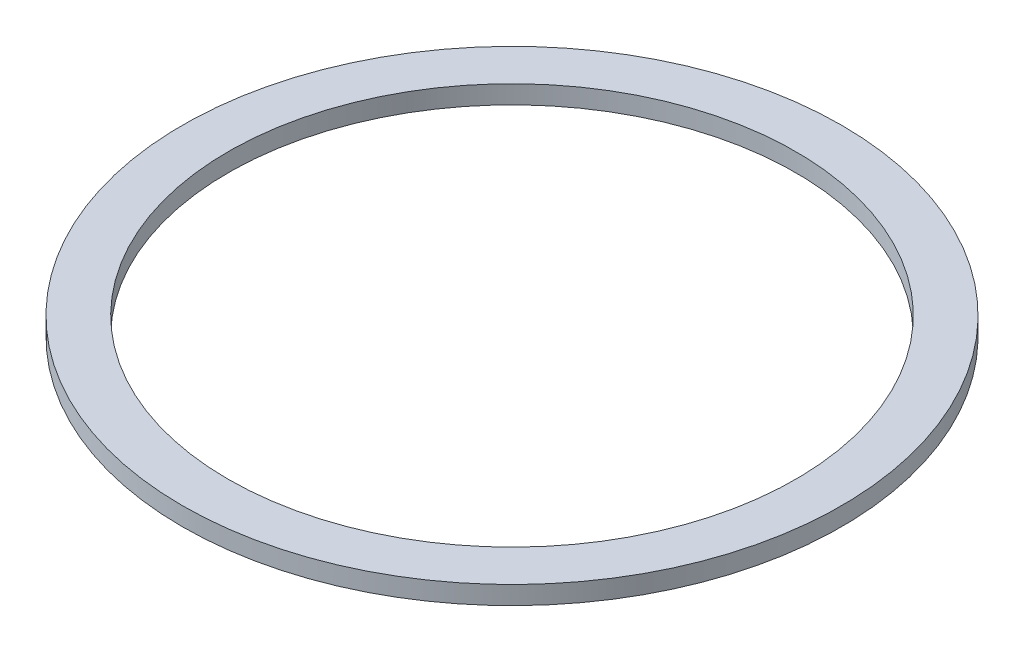
from build123d import *

# Parameters (mm, degrees)
ESQUISSE1_R        = 18
ESQUISSE1_R_2      = 15.5
BOSS_EXTRU_1_DEPTH = 1


with BuildPart() as part:
    # Esquisse1 → Boss.-Extru.1 (new body)
    with BuildSketch(Plane(origin=(0, 0, 0), x_dir=(1, 0, 0), z_dir=(0, 1, 0))):
        Circle(ESQUISSE1_R)
        Circle(ESQUISSE1_R_2, mode=Mode.SUBTRACT)
    extrude(amount=BOSS_EXTRU_1_DEPTH)


solid = part.part
